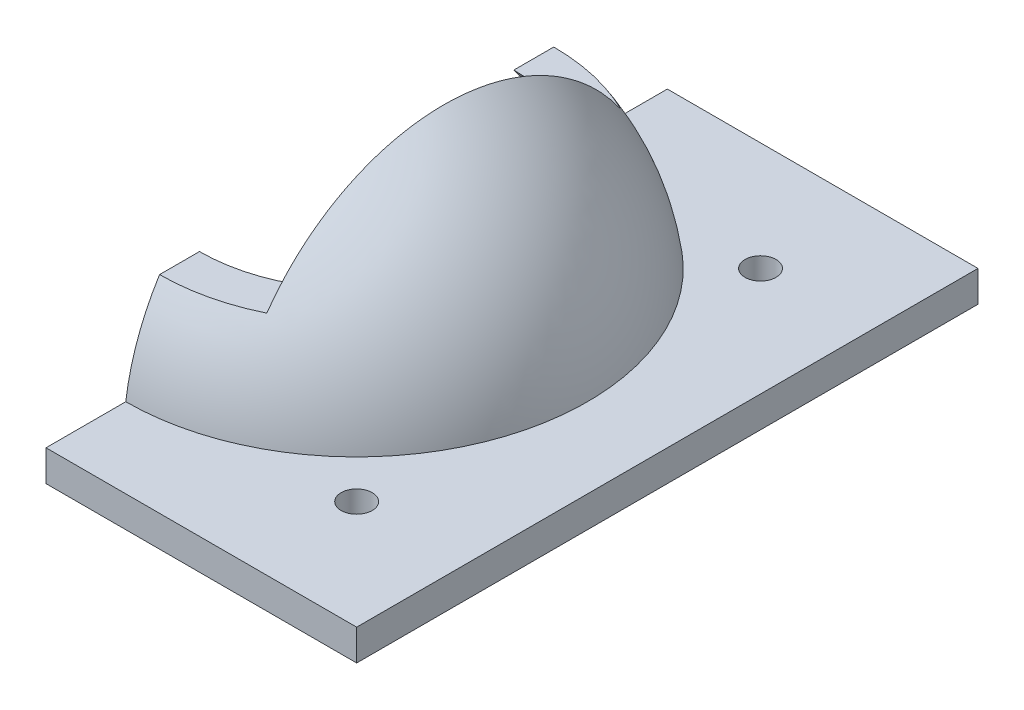
from build123d import *

# Parameters (mm, degrees)
SKETCH2_W            = 14.224
SKETCH2_H            = 12.608842622
CUT_EXTRUDE1_DEPTH   = 63.5
SKETCH3_W            = 50.8
SKETCH3_H            = 50.8
SKETCH3_R            = 16.51
BOSS_EXTRUDE1_DEPTH  = 2.54
SKETCH5_R            = 1.27
CUT_EXTRUDE3_DEPTH   = 39.978411724
LPATTERN1_COUNT      = 2
LPATTERN1_PITCH      = 33.02
LPATTERN1_COUNT_DIR2 = 2
LPATTERN1_PITCH_DIR2 = 33.02
SKETCH7_W            = 55.925579977
SKETCH7_H            = 24.805472435
CUT_EXTRUDE4_DEPTH   = 25.4


with BuildPart() as part:
    # Sketch1 → Revolve1 (revolve)
    with BuildSketch(Plane.XY):
        with BuildLine():
            Line((19.05, 0), (16.383, 0))
            ThreePointArc((16.383, 0), (11.584530396, 11.584530396), (0, 16.383))
            Line((0, 16.383), (0, 19.05))
            ThreePointArc((0, 19.05), (13.470384182, 13.470384182), (19.05, 0))
        make_face()
    revolve(axis=Axis((0, 19.05, 0), (0, -1, 0)))

    # Sketch2 → Cut-Extrude1 (cut, symmetric)
    with BuildSketch(Plane.XY):
        with Locations((0, 16.464421311)):
            Rectangle(SKETCH2_W, SKETCH2_H)
    extrude(amount=CUT_EXTRUDE1_DEPTH, both=True, mode=Mode.SUBTRACT)

    # Sketch3 → Boss-Extrude1 (add)
    with BuildSketch(Plane.XZ):
        Rectangle(SKETCH3_W, SKETCH3_H)
        Circle(SKETCH3_R, mode=Mode.SUBTRACT)
    extrude(amount=-BOSS_EXTRUDE1_DEPTH)

    # Sketch5 → Cut-Extrude3 (cut, through all)
    with BuildSketch(Plane(origin=(0, 2.54, 0), x_dir=(1, 0, 0), z_dir=(0, 1, 0))):
        with Locations((-16.51, 16.51)):
            Circle(SKETCH5_R)
    cut_extrude3 = extrude(amount=-CUT_EXTRUDE3_DEPTH, mode=Mode.SUBTRACT)

    # LPattern1: Cut-Extrude3 2 × 2
    with Locations(*[(i * LPATTERN1_PITCH, 0, j * LPATTERN1_PITCH_DIR2) for i in range(LPATTERN1_COUNT) for j in range(LPATTERN1_COUNT_DIR2) if (i, j) != (0, 0)]):
        add(cut_extrude3, mode=Mode.SUBTRACT)

    # Sketch7 → Cut-Extrude4 (cut)
    with BuildSketch(Plane.ZY.offset(25.4)):
        with Locations((-0.382276116, 9.761847735)):
            Rectangle(SKETCH7_W, SKETCH7_H)
    extrude(amount=-CUT_EXTRUDE4_DEPTH, mode=Mode.SUBTRACT)


solid = part.part
